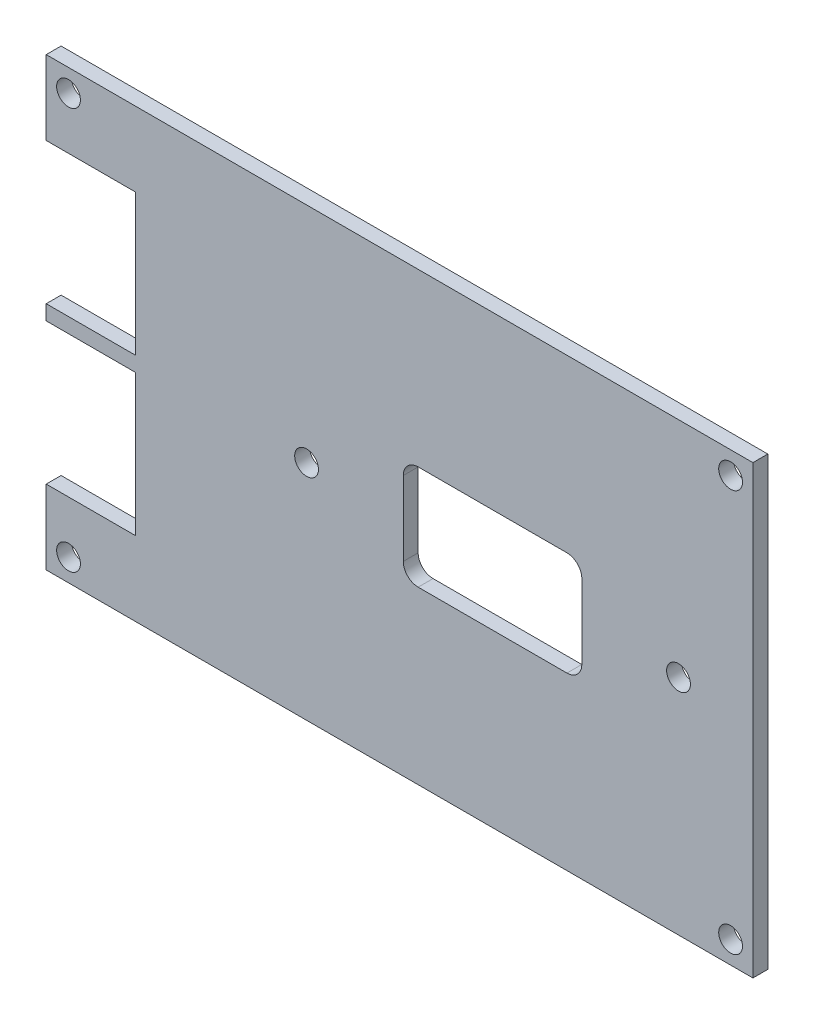
from build123d import *

# Parameters (mm, degrees)
SKETCH1_R           = 1.6
BOSS_EXTRUDE1_DEPTH = 2


with BuildPart() as part:
    # Sketch1 → Boss-Extrude1 (new body)
    with BuildSketch(Plane.XY):
        Polygon((-39.5636369, 18.881491211), (55.4363631, 18.881491211), (55.4363631, -41.118508789), (-39.5636369, -41.118508789), (-39.5636369, -31.118508789), (-27.5636369, -31.118508789), (-27.5636369, -12.118508789), (-39.5636369, -12.118508789), (-39.5636369, -10.118508789), (-27.5636369, -10.118508789), (-27.5636369, 8.881491211), (-39.5636369, 8.881491211), align=None)
        with Locations((45.4363631, -11.118508789)):
            Circle(SKETCH1_R, mode=Mode.SUBTRACT)
        with Locations((-4.5636369, -11.118508789)):
            Circle(SKETCH1_R, mode=Mode.SUBTRACT)
        with Locations((-36.5636369, 15.881491211)):
            Circle(SKETCH1_R, mode=Mode.SUBTRACT)
        with Locations((52.4363631, 15.881491211)):
            Circle(SKETCH1_R, mode=Mode.SUBTRACT)
        with Locations((-36.5636369, -38.118508789)):
            Circle(SKETCH1_R, mode=Mode.SUBTRACT)
        with Locations((52.4363631, -38.118508789)):
            Circle(SKETCH1_R, mode=Mode.SUBTRACT)
        with BuildLine():
            Line((10.4363631, -4.118508789), (30.4363631, -4.118508789))
            ThreePointArc((30.4363631, -4.118508789), (31.850576663, -4.704295227), (32.4363631, -6.118508789))
            Line((32.4363631, -6.118508789), (32.4363631, -16.118508789))
            ThreePointArc((32.4363631, -16.118508789), (31.850576663, -17.532722351), (30.4363631, -18.118508789))
            Line((30.4363631, -18.118508789), (10.4363631, -18.118508789))
            ThreePointArc((10.4363631, -18.118508789), (9.022149538, -17.532722351), (8.4363631, -16.118508789))
            Line((8.4363631, -16.118508789), (8.4363631, -6.118508789))
            ThreePointArc((8.4363631, -6.118508789), (9.022149538, -4.704295227), (10.4363631, -4.118508789))
        make_face(mode=Mode.SUBTRACT)
    extrude(amount=BOSS_EXTRUDE1_DEPTH)


solid = part.part
